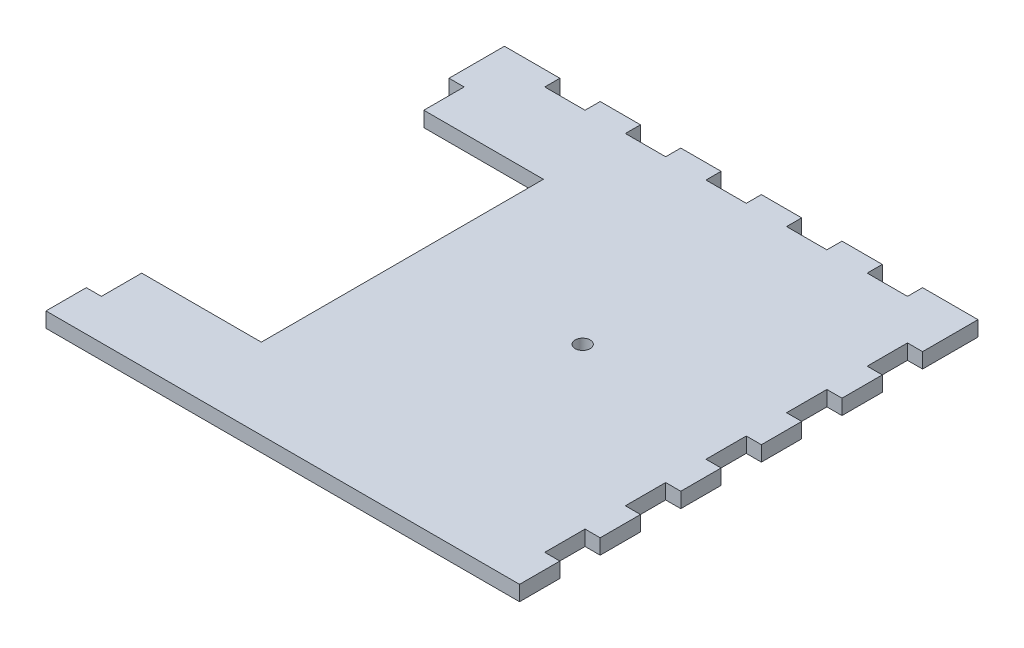
from build123d import *

# Parameters (mm, degrees)
SKETCH1_W               = 279.4
SKETCH1_H               = 279.4
BOSS_EXTRUDE1_DEPTH     = 9.525
SKETCH2_W               = 25.4
SKETCH2_H               = 9.525
BOSS_EXTRUDE2_DEPTH     = 9.525
LPATTERN1_COUNT         = 6
LPATTERN1_PITCH         = 50.8
MIRROR1_COPY_1_SKETCH_W = 25.4
MIRROR1_COPY_1_SKETCH_H = 9.525
MIRROR1_COPY_1_DEPTH    = 9.525
MIRROR1_COPY_2_SKETCH_W = 25.4
MIRROR1_COPY_2_SKETCH_H = 9.525
MIRROR1_COPY_2_DEPTH    = 9.525
MIRROR1_COPY_3_SKETCH_W = 25.4
MIRROR1_COPY_3_SKETCH_H = 9.525
MIRROR1_COPY_3_DEPTH    = 9.525
MIRROR1_COPY_4_SKETCH_W = 25.4
MIRROR1_COPY_4_SKETCH_H = 9.525
MIRROR1_COPY_4_DEPTH    = 9.525
MIRROR1_COPY_5_SKETCH_W = 25.4
MIRROR1_COPY_5_SKETCH_H = 9.525
MIRROR1_COPY_5_DEPTH    = 9.525
MIRROR1_COPY_6_SKETCH_W = 25.4
MIRROR1_COPY_6_SKETCH_H = 9.525
MIRROR1_COPY_6_DEPTH    = 9.525
SKETCH3_W               = 25.4
SKETCH3_H               = 9.525
BOSS_EXTRUDE3_DEPTH     = 9.525
LPATTERN2_COUNT         = 6
LPATTERN2_PITCH         = 50.8
SKETCH5_W               = 9.525
SKETCH5_H               = 9.525
BOSS_EXTRUDE4_DEPTH     = 9.525
SKETCH6_R               = 4.7625
CUT_EXTRUDE1_DEPTH      = 212.250862424
SKETCH8_W               = 84.891093183
SKETCH8_H               = 177.8
CUT_EXTRUDE3_DEPTH      = 212.250862424


with BuildPart() as part:
    # Sketch1 → Boss-Extrude1 (new body)
    with BuildSketch(Plane(origin=(0, 0, 0), x_dir=(1, 0, 0), z_dir=(0, 1, 0))):
        Rectangle(SKETCH1_W, SKETCH1_H)
    extrude(amount=BOSS_EXTRUDE1_DEPTH)

    # Sketch2 → Boss-Extrude2 (add)
    with BuildSketch(Plane(origin=(139.7, 0, 0), x_dir=(0, 0, -1), z_dir=(1, 0, 0))):
        with Locations((-127, 4.7625)):
            Rectangle(SKETCH2_W, SKETCH2_H)
    boss_extrude2 = extrude(amount=BOSS_EXTRUDE2_DEPTH)

    # LPattern1: Boss-Extrude2 ×6
    with Locations(*[(0, 0, -i * LPATTERN1_PITCH) for i in range(1, LPATTERN1_COUNT)]):
        add(boss_extrude2)

    # Mirror1 copy 1 sketch → Mirror1 copy 1 (add)
    with BuildSketch(Plane(origin=(-139.7, 0, -50.8), x_dir=(0, 0, -1), z_dir=(-1, 0, 0))):
        with Locations((-127, -4.7625)):
            Rectangle(MIRROR1_COPY_1_SKETCH_W, MIRROR1_COPY_1_SKETCH_H)
    extrude(amount=MIRROR1_COPY_1_DEPTH)

    # Mirror1 copy 2 sketch → Mirror1 copy 2 (add)
    with BuildSketch(Plane(origin=(-139.7, 0, -101.6), x_dir=(0, 0, -1), z_dir=(-1, 0, 0))):
        with Locations((-127, -4.7625)):
            Rectangle(MIRROR1_COPY_2_SKETCH_W, MIRROR1_COPY_2_SKETCH_H)
    extrude(amount=MIRROR1_COPY_2_DEPTH)

    # Mirror1 copy 3 sketch → Mirror1 copy 3 (add)
    with BuildSketch(Plane(origin=(-139.7, 0, -152.4), x_dir=(0, 0, -1), z_dir=(-1, 0, 0))):
        with Locations((-127, -4.7625)):
            Rectangle(MIRROR1_COPY_3_SKETCH_W, MIRROR1_COPY_3_SKETCH_H)
    extrude(amount=MIRROR1_COPY_3_DEPTH)

    # Mirror1 copy 4 sketch → Mirror1 copy 4 (add)
    with BuildSketch(Plane(origin=(-139.7, 0, -203.2), x_dir=(0, 0, -1), z_dir=(-1, 0, 0))):
        with Locations((-127, -4.7625)):
            Rectangle(MIRROR1_COPY_4_SKETCH_W, MIRROR1_COPY_4_SKETCH_H)
    extrude(amount=MIRROR1_COPY_4_DEPTH)

    # Mirror1 copy 5 sketch → Mirror1 copy 5 (add)
    with BuildSketch(Plane(origin=(-139.7, 0, -254), x_dir=(0, 0, -1), z_dir=(-1, 0, 0))):
        with Locations((-127, -4.7625)):
            Rectangle(MIRROR1_COPY_5_SKETCH_W, MIRROR1_COPY_5_SKETCH_H)
    extrude(amount=MIRROR1_COPY_5_DEPTH)

    # Mirror1 copy 6 sketch → Mirror1 copy 6 (add)
    with BuildSketch(Plane(origin=(-139.7, 0, 0), x_dir=(0, 0, -1), z_dir=(-1, 0, 0))):
        with Locations((-127, -4.7625)):
            Rectangle(MIRROR1_COPY_6_SKETCH_W, MIRROR1_COPY_6_SKETCH_H)
    extrude(amount=MIRROR1_COPY_6_DEPTH)

    # Sketch3 → Boss-Extrude3 (add)
    with BuildSketch(Plane(origin=(0, 0, -139.7), x_dir=(-1, 0, 0), z_dir=(0, 0, -1))):
        with Locations((-127, 4.7625)):
            Rectangle(SKETCH3_W, SKETCH3_H)
    boss_extrude3 = extrude(amount=BOSS_EXTRUDE3_DEPTH)

    # LPattern2: Boss-Extrude3 ×6
    with Locations(*[(-i * LPATTERN2_PITCH, 0, 0) for i in range(1, LPATTERN2_COUNT)]):
        add(boss_extrude3)

    # Sketch5 → Boss-Extrude4 (add)
    with BuildSketch(Plane(origin=(0, 0, -139.7), x_dir=(-1, 0, 0), z_dir=(0, 0, -1))):
        with Locations((-144.4625, 4.7625)):
            Rectangle(SKETCH5_W, SKETCH5_H)
    boss_extrude4 = extrude(amount=BOSS_EXTRUDE4_DEPTH)

    # Mirror2: Boss-Extrude4 across plane
    add(boss_extrude4.mirror(Plane(origin=(0, 0, 0), x_dir=(0, 0, 1), z_dir=(1, 0, 0))))

    # Sketch6 → Cut-Extrude1 (cut, through all)
    with BuildSketch(Plane(origin=(0, 9.525, 0), x_dir=(1, 0, 0), z_dir=(0, 1, 0))):
        with Locations((38.1, 11.176)):
            Circle(SKETCH6_R)
    extrude(amount=-CUT_EXTRUDE1_DEPTH, mode=Mode.SUBTRACT)

    # Sketch8 → Cut-Extrude3 (cut, through all)
    with BuildSketch(Plane(origin=(0, 9.525, 0), x_dir=(1, 0, 0), z_dir=(0, 1, 0))):
        with Locations((-106.779453409, 0)):
            Rectangle(SKETCH8_W, SKETCH8_H)
    extrude(amount=-CUT_EXTRUDE3_DEPTH, mode=Mode.SUBTRACT)


solid = part.part
